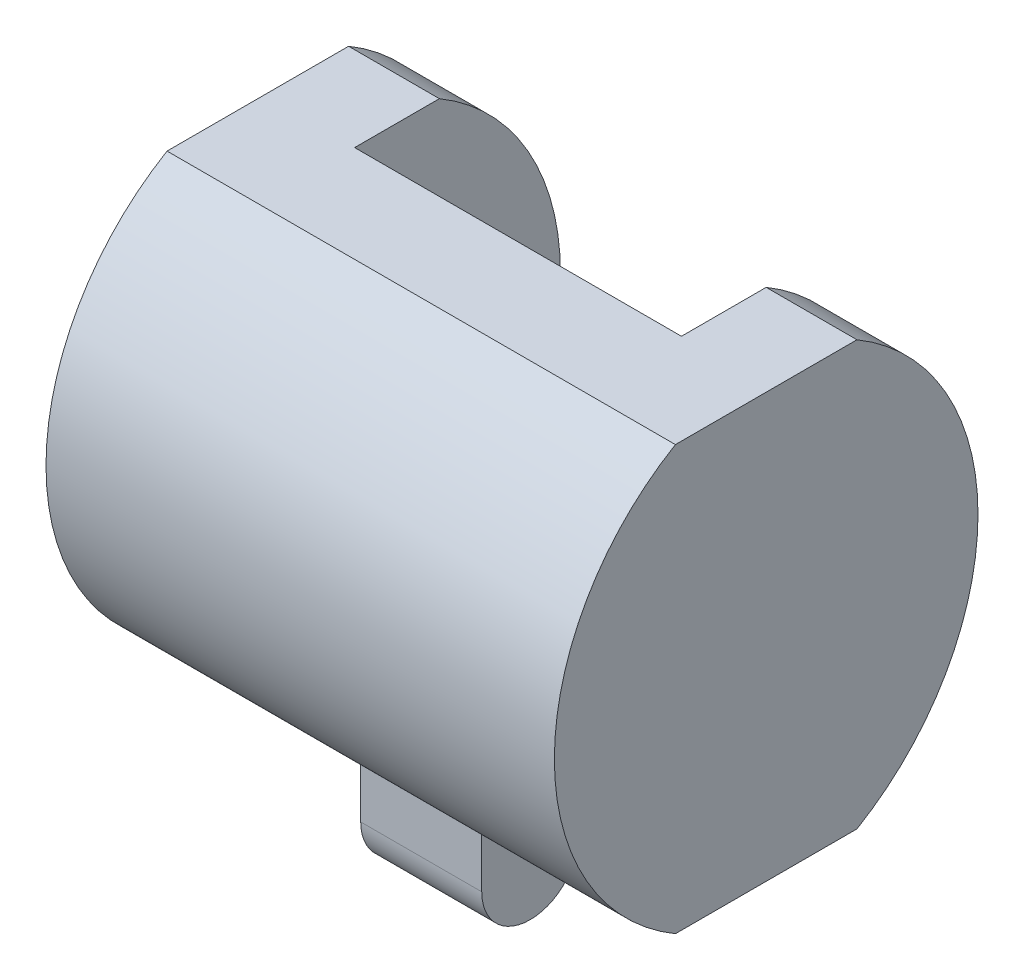
from build123d import *

# Parameters (mm, degrees)
BOSS_EXTRUDE1_DEPTH = 21
CUT_EXTRUDE1_DEPTH  = 13.5
BOSS_EXTRUDE2_DEPTH = 5


with BuildPart() as part:
    # Sketch1 → Boss-Extrude1 (new, symmetric)
    with BuildSketch(Plane(origin=(0, 0, 0), x_dir=(0, 0, -1), z_dir=(1, 0, 0))):
        with BuildLine():
            Line((0, 17.5), (-15, 17.5))
            ThreePointArc((-15, 17.5), (-25, 0), (-15, -17.5))
            Line((-15, -17.5), (0, -17.5))
            ThreePointArc((0, -17.5), (10, 0), (0, 17.5))
        make_face()
    extrude(amount=BOSS_EXTRUDE1_DEPTH, both=True)

    # Sketch2 → Cut-Extrude1 (cut, symmetric)
    with BuildSketch(Plane(origin=(0, 0, 0), x_dir=(0, 0, -1), z_dir=(1, 0, 0))):
        with BuildLine():
            Line((-7, -17.5), (0, -17.5))
            ThreePointArc((0, -17.5), (10, 0), (0, 17.5))
            Line((0, 17.5), (-7, 17.5))
            ThreePointArc((-7, 17.5), (-17, 0), (-7, -17.5))
        make_face()
    extrude(amount=CUT_EXTRUDE1_DEPTH, both=True, mode=Mode.SUBTRACT)

    # Sketch3 → Boss-Extrude2 (add, symmetric)
    with BuildSketch(Plane(origin=(0, 0, 0), x_dir=(0, 0, -1), z_dir=(1, 0, 0))):
        with BuildLine():
            Line((-15, -17.5), (-15, -22.5))
            ThreePointArc((-15, -22.5), (-11, -26.5), (-7, -22.5))
            Line((-7, -22.5), (-7, -17.5))
            Line((-7, -17.5), (-15, -17.5))
        make_face()
    extrude(amount=BOSS_EXTRUDE2_DEPTH, both=True)


solid = part.part
